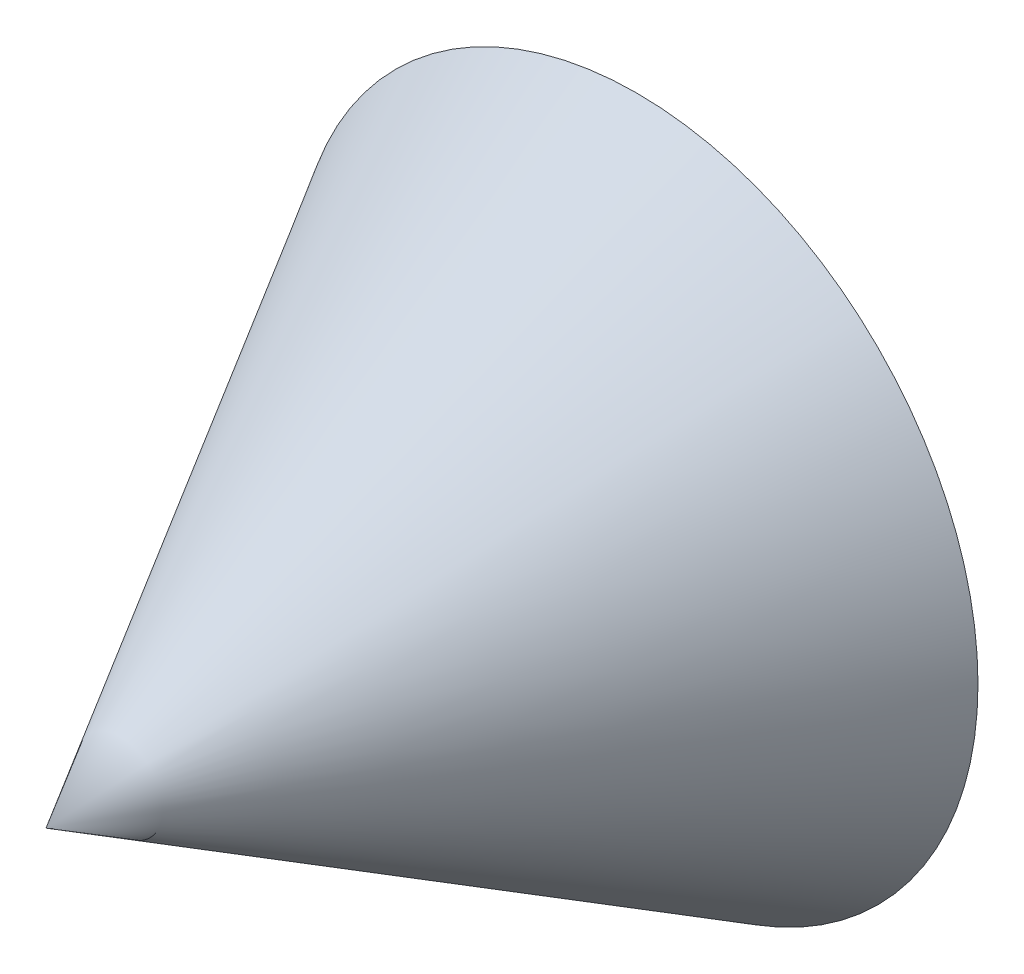
from build123d import *


with BuildPart() as part:
    # 草圖1 → 旋轉1 (revolve)
    with BuildSketch(Plane(origin=(0, 0, 0), x_dir=(0, 0, -1), z_dir=(1, 0, 0))):
        Polygon((0, 0), (12.990381057, 7.5), (12.990381057, 6.345299462), (2, 0), align=None)
    revolve(axis=Axis((0, 0, 0), (0, 0, -1)))


solid = part.part
